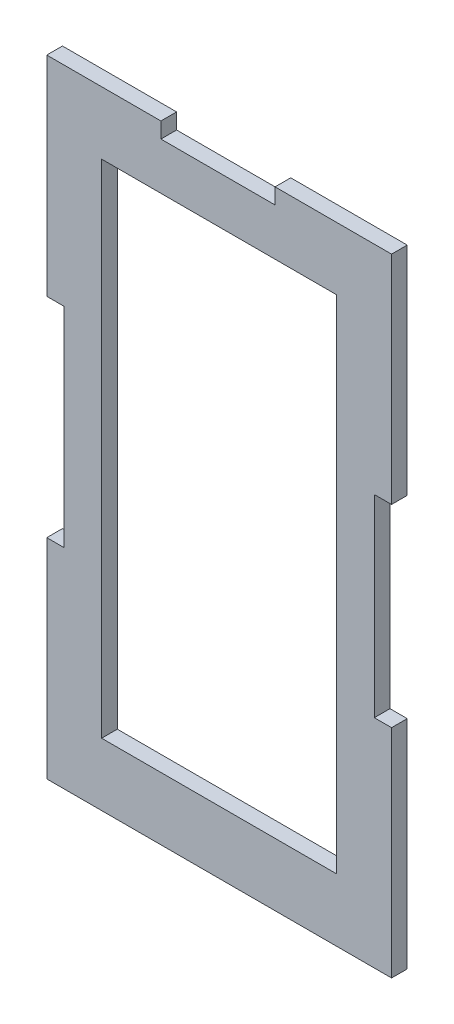
from build123d import *

# Parameters (mm, degrees)
SKETCH1_W           = 55.88
SKETCH1_H           = 101.6
BOSS_EXTRUDE1_DEPTH = 2.54
SKETCH2_W           = 2.794
SKETCH2_H           = 31.326666666
SKETCH2_H_2         = 33.866666666
CUT_EXTRUDE1_DEPTH  = 59.032191067
SKETCH3_W           = 38.1
SKETCH3_H           = 81.28
CUT_EXTRUDE2_DEPTH  = 59.032191067
CAVITY1_START       = 48.26
CAVITY1_OUTLINE_W   = 18.499605322
CAVITY1_OUTLINE_H   = 2.54
CAVITY1_DEPTH       = 2.54


# Read off the part's stored shape, not the designer's step: Cavity1
with BuildPart() as part:
    # Sketch1 → Boss-Extrude1 (new body)
    with BuildSketch(Plane.XY):
        Rectangle(SKETCH1_W, SKETCH1_H)
    extrude(amount=BOSS_EXTRUDE1_DEPTH)

    # Sketch2 → Cut-Extrude1 (cut, through all)
    with BuildSketch(Plane(origin=(0, 0, 0), x_dir=(-1, 0, 0), z_dir=(0, 0, -1))):
        with Locations((-26.543, 0)):
            Rectangle(SKETCH2_W, SKETCH2_H)
        with Locations((26.543, 0)):
            Rectangle(SKETCH2_W, SKETCH2_H_2)
    extrude(amount=-CUT_EXTRUDE1_DEPTH, mode=Mode.SUBTRACT)

    # Sketch3 → Cut-Extrude2 (cut, through all)
    with BuildSketch(Plane.XY.offset(2.54)):
        Rectangle(SKETCH3_W, SKETCH3_H)
    extrude(amount=-CUT_EXTRUDE2_DEPTH, mode=Mode.SUBTRACT)

    # Cavity1 outline → Cavity1 (cut)
    with BuildSketch(Plane(origin=(0, 0, 0), x_dir=(1, 0, 0), z_dir=(0, 1, 0)).offset(CAVITY1_START)):
        with Locations((-0.190592016, -1.27)):
            Rectangle(CAVITY1_OUTLINE_W, CAVITY1_OUTLINE_H)
    extrude(amount=CAVITY1_DEPTH, mode=Mode.SUBTRACT)


solid = part.part
